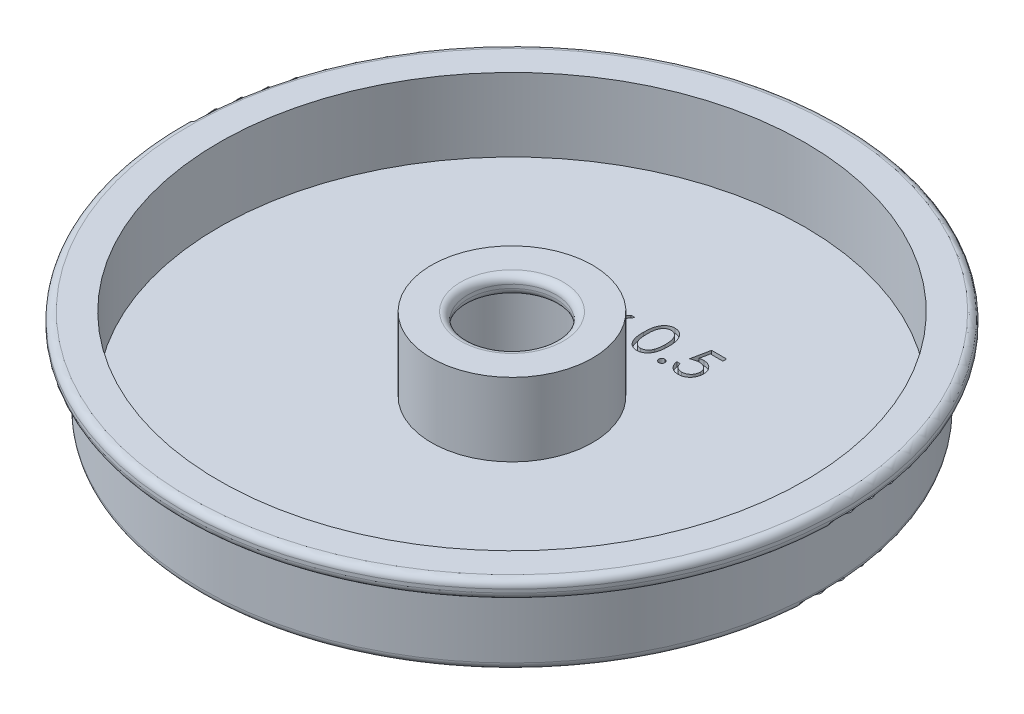
from build123d import *

# Parameters (mm, degrees)
CUT_EXTRUDE1_DEPTH = 0.79375


with BuildPart() as part:
    # Sketch1 → Revolve2 (revolve)
    with BuildSketch(Plane.XY):
        with BuildLine():
            Line((13.97, 3.211825196), (13.97, 15.911825196))
            Line((13.97, 15.911825196), (8.89, 15.911825196))
            ThreePointArc((8.89, 15.911825196), (7.991974388, 15.539850808), (7.62, 14.641825196))
            Line((7.62, 14.641825196), (7.62, 14.006825196))
            ThreePointArc((7.62, 14.006825196), (7.991974388, 13.108799584), (8.89, 12.736825196))
            Line((8.89, 12.736825196), (9.525, 12.736825196))
            ThreePointArc((9.525, 12.736825196), (10.423025612, 12.364850808), (10.795, 11.466825196))
            Line((10.795, 11.466825196), (10.795, 1.306825196))
            ThreePointArc((10.795, 1.306825196), (11.166974388, 0.408799584), (12.065, 0.036825196))
            Line((12.065, 0.036825196), (52.705, 0.036825196))
            ThreePointArc((52.705, 0.036825196), (53.603025612, 0.408799584), (53.975, 1.306825196))
            Line((53.975, 1.306825196), (53.975, 11.503650391))
            ThreePointArc((53.975, 11.503650391), (54.346974388, 12.401676004), (55.245, 12.773650391))
            Line((55.245, 12.773650391), (55.88, 12.773650391))
            ThreePointArc((55.88, 12.773650391), (56.778025612, 13.145624779), (57.15, 14.043650391))
            Line((57.15, 14.043650391), (57.15, 14.641825196))
            ThreePointArc((57.15, 14.641825196), (56.778025612, 15.539850808), (55.88, 15.911825196))
            Line((55.88, 15.911825196), (50.8, 15.911825196))
            Line((50.8, 15.911825196), (50.8, 3.211825196))
            Line((50.8, 3.211825196), (13.97, 3.211825196))
        make_face()
    revolve(axis=Axis((0, 0, 0), (0, 1, 0)))

    # Sketch2 → Cut-Extrude1 (cut)
    # profile 1 of 5: a face of its own
    with BuildSketch(Plane(origin=(0, 3.211825196, 0), x_dir=(1, 0, 0), z_dir=(0, 1, 0))):
        Polygon((-8.742863875, 24.357604302), (-8.627108666, 24.357604302), (-8.627108666, 19.961450455), (-7.894416359, 19.961450455), (-7.894416359, 19.310168404), (-8.627108666, 19.310168404), (-8.627108666, 17.844783789), (-9.196980461, 17.844783789), (-9.196980461, 19.310168404), (-12.209159948, 19.310168404), align=None)
        Polygon((-9.196980461, 19.961450455), (-9.196980461, 22.719222891), (-11.089768923, 19.961450455), align=None, mode=Mode.SUBTRACT)
    # profile 2 of 5: a face of its own
    with BuildSketch(Plane(origin=(0, 3.211825196, 0), x_dir=(1, 0, 0), z_dir=(0, 1, 0))):
        Polygon((-4.882236872, 22.485168404), (-4.20424208, 22.485168404), (-3.009800974, 20.811170007), (-1.815359868, 22.485168404), (-1.137365077, 22.485168404), (-2.670167561, 20.336700856), (-0.893134307, 17.844783789), (-1.571129099, 17.844783789), (-3.009800974, 19.86095967), (-4.448472849, 17.844783789), (-5.126467641, 17.844783789), (-3.348162352, 20.336700856), align=None)
    # profile 3 of 5: a face of its own
    with BuildSketch(Plane(origin=(0, 3.211825196, 0), x_dir=(1, 0, 0), z_dir=(0, 1, 0))):
        with BuildLine():
            add(Edge.make_bspline(
                [(1.793404154, 21.017239718), (1.793999273, 21.119016407), (1.795155299, 21.316719093), (1.80801572, 21.604799801), (1.829379556, 21.875056325), (1.858657361, 22.127501602), (1.894286268, 22.362200804), (1.94184865, 22.57852672), (1.995937592, 22.777480578), (2.058625601, 22.959711151), (2.12936059, 23.127673555), (2.206348463, 23.284473564), (2.29264459, 23.429873926), (2.383316989, 23.566195346), (2.482036033, 23.691206335), (2.58599241, 23.806672309), (2.699243529, 23.90992467), (2.817939558, 24.003988676), (2.943155143, 24.086447003), (3.071321123, 24.159077829), (3.203319672, 24.22112616), (3.339511176, 24.269913093), (3.478671531, 24.310209915), (3.621287209, 24.337767006), (3.767593683, 24.355105969), (3.866347858, 24.356763623), (3.916430997, 24.357604302)],
                knots=[0, 0, 0, 0, 1.646270934, 3.197905019, 4.663502075, 6.030701355, 7.308322542, 8.50163776, 9.611534131, 10.641858119, 11.616356847, 12.558055219, 13.465016945, 14.349605745, 15.204443733, 16.039544428, 16.859896111, 17.680448484, 18.487036065, 19.28249412, 20.06191084, 20.843045899, 21.620316918, 22.403196591, 23.190181807, 24, 24, 24, 24], degree=3))
            add(Edge.make_bspline(
                [(3.916430997, 24.357604302), (3.966932508, 24.356719266), (4.067364124, 24.354959207), (4.215845948, 24.338042911), (4.360897513, 24.309973874), (4.501900422, 24.270202963), (4.640012897, 24.220862235), (4.774154666, 24.159018465), (4.905158942, 24.087029663), (5.030943893, 24.002440629), (5.152890409, 23.908129928), (5.268003142, 23.801517657), (5.376292569, 23.683680309), (5.479117766, 23.555878642), (5.573561492, 23.415661417), (5.663501862, 23.265467389), (5.744005413, 23.102669963), (5.821538324, 22.9299854), (5.888461857, 22.742635619), (5.94881633, 22.541676696), (5.997582459, 22.324734957), (6.038202996, 22.092948626), (6.069671593, 21.845466478), (6.092590815, 21.58281902), (6.104697698, 21.304833454), (6.106977713, 21.114772785), (6.108147744, 21.017239718)],
                knots=[0, 0, 0, 0, 0.810914788, 1.612654377, 2.396697861, 3.181598691, 3.963628158, 4.749916497, 5.551656086, 6.361998678, 7.18212741, 8.025565596, 8.878627764, 9.750805457, 10.657531673, 11.591944965, 12.560506719, 13.57287815, 14.630710178, 15.753379473, 16.941251878, 18.199788006, 19.531962791, 20.947069417, 22.433333509, 24, 24, 24, 24], degree=3))
            add(Edge.make_bspline(
                [(6.108147744, 21.017239718), (6.106965583, 20.920132057), (6.104662192, 20.730921738), (6.092726538, 20.454186969), (6.069215879, 20.192933376), (6.039806328, 19.946534394), (5.999073867, 19.716015571), (5.948990208, 19.500579215), (5.893381765, 19.299294971), (5.824738639, 19.113811812), (5.749607779, 18.941542258), (5.66786478, 18.780674717), (5.580289524, 18.629787301), (5.484878515, 18.49008776), (5.383181608, 18.360586482), (5.273022192, 18.243569367), (5.157505559, 18.136216862), (5.035200176, 18.040691766), (4.907453504, 17.957080764), (4.776899179, 17.882307064), (4.641220755, 17.82201346), (4.503492969, 17.770242743), (4.361745791, 17.730690494), (4.21615591, 17.703342213), (4.067463882, 17.68416186), (3.966949614, 17.682698675), (3.916430997, 17.681963276)],
                knots=[0, 0, 0, 0, 1.561518951, 3.042555995, 4.452378317, 5.7783523, 7.031515105, 8.214008947, 9.334062868, 10.386615937, 11.391082383, 12.354592575, 13.286541444, 14.194233754, 15.072674879, 15.931287219, 16.775624067, 17.606195743, 18.42308326, 19.229000347, 20.022332153, 20.807536673, 21.593273796, 22.3848459, 23.188221202, 24, 24, 24, 24], degree=3))
            add(Edge.make_bspline(
                [(3.916430997, 17.681963276), (3.866349247, 17.682809378), (3.767597812, 17.684477726), (3.621271269, 17.701738353), (3.47924455, 17.729488766), (3.340816811, 17.768344605), (3.205277848, 17.815905808), (3.074474585, 17.877870348), (2.946952644, 17.949233588), (2.82305225, 18.030505281), (2.705101615, 18.123617477), (2.592437002, 18.226604115), (2.487888754, 18.342035162), (2.39058118, 18.468087965), (2.29809962, 18.603602848), (2.2130289, 18.750430039), (2.134341779, 18.907987346), (2.06241716, 19.077292698), (1.998647442, 19.260816639), (1.942318029, 19.46065872), (1.897842343, 19.678582803), (1.859773267, 19.912838597), (1.829067601, 20.164432728), (1.808104753, 20.433501783), (1.795148367, 20.71987809), (1.793996168, 20.916310395), (1.793404154, 21.017239718)],
                knots=[0, 0, 0, 0, 0.810891512, 1.598919785, 2.382837074, 3.152667961, 3.926044502, 4.706494248, 5.493654104, 6.291793342, 7.103789334, 7.925228297, 8.761435821, 9.622817696, 10.50288917, 11.416980706, 12.369136599, 13.353924996, 14.394355917, 15.514179734, 16.714354668, 17.994756427, 19.357759367, 20.818452758, 22.365282078, 24, 24, 24, 24], degree=3))
        make_face()
        with BuildLine():
            add(Edge.make_bspline(
                [(2.363275949, 21.019783789), (2.36349266, 20.934968292), (2.363913254, 20.770358068), (2.374900932, 20.531156723), (2.38986921, 20.308053412), (2.409175564, 20.100764853), (2.437846627, 19.909992688), (2.469971799, 19.734424834), (2.509066191, 19.574990418), (2.555321437, 19.43059539), (2.608006656, 19.298789223), (2.665530151, 19.176141304), (2.727326034, 19.061202791), (2.796485065, 18.955006102), (2.871805251, 18.857204918), (2.951585307, 18.766068208), (3.03880271, 18.684793685), (3.1594595, 18.587317819), (3.318747389, 18.486590248), (3.519444501, 18.398876628), (3.725671547, 18.343754171), (3.865645958, 18.336744214), (3.935511526, 18.333245327)],
                knots=[0, 0, 0, 0, 1.459021318, 2.831673884, 4.118529203, 5.306027144, 6.411944654, 7.436330062, 8.375795394, 9.233974572, 10.042671642, 10.816086306, 11.563610507, 12.285937304, 12.993564865, 13.685989202, 14.367179055, 15.041617293, 16.353048772, 17.594441528, 18.799311195, 20, 20, 20, 20], degree=3))
            add(Edge.make_bspline(
                [(3.935511526, 18.333245327), (4.005829016, 18.336144158), (4.146318817, 18.341935835), (4.351575845, 18.397813544), (4.550839335, 18.482122566), (4.706998427, 18.58181304), (4.82580247, 18.67675158), (4.910923295, 18.7576953), (4.989050154, 18.848329516), (5.063149347, 18.946118239), (5.131110813, 19.052929746), (5.192911077, 19.168250418), (5.24930515, 19.292400498), (5.281434419, 19.379068453), (5.297861286, 19.423379542)],
                knots=[0, 0, 0, 0, 1.353760809, 2.704726607, 4.075137775, 5.516104923, 6.260822281, 7.007110065, 7.778089737, 8.566572457, 9.372053459, 10.217411131, 11.088608312, 12, 12, 12, 12], degree=3))
            add(Edge.make_bspline(
                [(5.297861286, 19.423379542), (5.317005207, 19.480039212), (5.355875578, 19.595082642), (5.405971226, 19.77354241), (5.445423593, 19.960781711), (5.480917128, 20.155681565), (5.505143386, 20.359679309), (5.52464299, 20.572143748), (5.536128665, 20.793235077), (5.537552428, 20.943448846), (5.538275949, 21.019783789)],
                knots=[0, 0, 0, 0, 0.884706709, 1.796334032, 2.740027952, 3.714592787, 4.726048262, 5.777819803, 6.87074269, 8, 8, 8, 8], degree=3))
            add(Edge.make_bspline(
                [(5.538275949, 21.019783789), (5.537277749, 21.096106385), (5.535325055, 21.245409698), (5.527861106, 21.464064111), (5.508586906, 21.671741335), (5.487179934, 21.869336049), (5.455616404, 22.055754456), (5.421584383, 22.232557152), (5.375862183, 22.397553783), (5.32702202, 22.553327596), (5.27112316, 22.698108783), (5.209590328, 22.832572367), (5.143873708, 22.95736751), (5.072495643, 23.072151819), (4.996303476, 23.177439432), (4.913286208, 23.27111934), (4.826736846, 23.356094982), (4.70551138, 23.453091357), (4.546808026, 23.551991148), (4.349330923, 23.643006169), (4.143825611, 23.695272643), (4.004899487, 23.702641704), (3.935511526, 23.70632225)],
                knots=[0, 0, 0, 0, 1.31362396, 2.569729283, 3.763502607, 4.902122613, 5.988968491, 7.01645872, 7.998833611, 8.933434873, 9.825090667, 10.667526885, 11.477055099, 12.250526234, 12.991942729, 13.710640831, 14.402115721, 15.076753259, 16.378508321, 17.609869233, 18.806226677, 20, 20, 20, 20], degree=3))
            add(Edge.make_bspline(
                [(3.935511526, 23.70632225), (3.865279452, 23.702636626), (3.724687357, 23.695258662), (3.517046068, 23.643200902), (3.31801103, 23.552463092), (3.159727347, 23.452763788), (3.038417335, 23.357807137), (2.952995877, 23.275463142), (2.872902107, 23.185390652), (2.79911928, 23.086690035), (2.730014437, 22.980617154), (2.666548886, 22.866337538), (2.609367445, 22.743272063), (2.556599786, 22.611525102), (2.510203442, 22.467142531), (2.471932966, 22.3079045), (2.436577884, 22.132895068), (2.411549325, 21.941089675), (2.389299368, 21.733749197), (2.375000351, 21.510088919), (2.363876498, 21.2704864), (2.363480141, 21.10502507), (2.363275949, 21.019783789)],
                knots=[0, 0, 0, 0, 1.207732386, 2.417664972, 3.655092373, 4.956220595, 5.625982001, 6.301752483, 6.994047911, 7.697131622, 8.419323945, 9.170223765, 9.943494443, 10.752040957, 11.610060368, 12.549350801, 13.567764191, 14.679664412, 15.874934091, 17.154273443, 18.533957287, 20, 20, 20, 20], degree=3))
        make_face(mode=Mode.SUBTRACT)
    # profile 4 of 5: a face of its own
    with BuildSketch(Plane(origin=(0, 3.211825196, 0), x_dir=(1, 0, 0), z_dir=(0, 1, 0))):
        with BuildLine():
            add(Edge.make_bspline(
                [(7.695647744, 18.821706866), (7.731008557, 18.81960562), (7.800329298, 18.815486375), (7.90054886, 18.787225838), (7.991253457, 18.737045125), (8.072047672, 18.670165513), (8.138643708, 18.58907481), (8.190612747, 18.499093661), (8.218627106, 18.398035058), (8.222716346, 18.328312648), (8.224814411, 18.292540199)],
                knots=[0, 0, 0, 0, 1.020151414, 1.999887582, 2.974338812, 3.990962822, 5.007586832, 5.987933904, 6.967670073, 8, 8, 8, 8], degree=3))
            add(Edge.make_bspline(
                [(8.224814411, 18.292540199), (8.222645249, 18.257627301), (8.218367695, 18.188779578), (8.190676963, 18.08848321), (8.138247643, 17.998445826), (8.072507013, 17.916254804), (7.991233484, 17.84923351), (7.90033442, 17.799479728), (7.800564565, 17.769195707), (7.731047807, 17.765337997), (7.695647744, 17.763373532)],
                knots=[0, 0, 0, 0, 1.009421747, 1.99056486, 2.972319754, 3.999869655, 5.017953583, 5.993804169, 6.978383603, 8, 8, 8, 8], degree=3))
            add(Edge.make_bspline(
                [(7.695647744, 17.763373532), (7.660222172, 17.765266916), (7.591062177, 17.768963296), (7.49166473, 17.800101531), (7.400212087, 17.848766951), (7.318954381, 17.916379773), (7.252663154, 17.99802289), (7.202542817, 18.089103292), (7.172443547, 18.188492471), (7.168485006, 18.257570752), (7.166481077, 18.292540199)],
                knots=[0, 0, 0, 0, 1.022052826, 1.995314843, 2.982371812, 4.00089066, 5.028879526, 6.005146991, 6.990147033, 8, 8, 8, 8], degree=3))
            add(Edge.make_bspline(
                [(7.166481077, 18.292540199), (7.168408029, 18.328371216), (7.172170165, 18.39832688), (7.202606006, 18.498473833), (7.252274276, 18.589493715), (7.319412635, 18.670041796), (7.400192429, 18.737510188), (7.491444116, 18.786613456), (7.591301568, 18.815715346), (7.660262456, 18.819675055), (7.695647744, 18.821706866)],
                knots=[0, 0, 0, 0, 1.032775665, 2.016367738, 2.991239715, 4.008302682, 5.025365648, 6.011011707, 6.979408107, 8, 8, 8, 8], degree=3))
        make_face()
    # profile 5 of 5: a face of its own
    with BuildSketch(Plane(origin=(0, 3.211825196, 0), x_dir=(1, 0, 0), z_dir=(0, 1, 0))):
        with BuildLine():
            Line((13.028019539, 24.194783789), (13.028019539, 23.543501738))
            Line((13.028019539, 23.543501738), (10.868103673, 23.543501738))
            Line((10.868103673, 23.543501738), (10.525926189, 21.873319446))
            add(Edge.make_bspline(
                [(10.525926189, 21.873319446), (10.593156133, 21.891880082), (10.723403515, 21.927838379), (10.915644977, 21.967763133), (11.098147975, 21.991830439), (11.216576147, 21.995116674), (11.27388292, 21.996706866)],
                knots=[0, 0, 0, 0, 1.100273476, 2.13160584, 3.095893838, 4, 4, 4, 4], degree=3))
            add(Edge.make_bspline(
                [(11.27388292, 21.996706866), (11.344791991, 21.995172097), (11.48421694, 21.992154357), (11.688213315, 21.963176859), (11.88294585, 21.917565871), (12.068007293, 21.85384721), (12.243740007, 21.772368123), (12.408527154, 21.670586802), (12.564842225, 21.551690616), (12.709880931, 21.414993237), (12.841460747, 21.264549732), (12.957150471, 21.102791881), (13.055416885, 20.931291694), (13.13444854, 20.748410589), (13.197557261, 20.556170411), (13.239561594, 20.35254844), (13.267531909, 20.139463993), (13.27065681, 19.993768559), (13.272250308, 19.919473292)],
                knots=[0, 0, 0, 0, 1.052922333, 2.070308379, 3.05430497, 4.020497103, 4.973039431, 5.925935799, 6.892292201, 7.88610001, 8.88166317, 9.857072816, 10.836096531, 11.812156883, 12.81219415, 13.836441305, 14.89672472, 16, 16, 16, 16], degree=3))
            add(Edge.make_bspline(
                [(13.272250308, 19.919473292), (13.271043671, 19.867725835), (13.268646705, 19.764930243), (13.256457267, 19.612268622), (13.232988182, 19.462838911), (13.201478169, 19.316621285), (13.160579782, 19.173892567), (13.111069641, 19.034244224), (13.050479706, 18.898545437), (12.984019925, 18.765512221), (12.909187029, 18.638152072), (12.826131737, 18.519046053), (12.738382917, 18.406407428), (12.643964975, 18.301444227), (12.542000312, 18.20484618), (12.433723801, 18.116040012), (12.319999439, 18.033523885), (12.199067786, 17.960647302), (12.073623566, 17.893585939), (11.94185523, 17.838570378), (11.806762245, 17.789384134), (11.666400256, 17.750178277), (11.521087196, 17.719457785), (11.370583532, 17.69859241), (11.215678602, 17.683395159), (11.110676793, 17.682443826), (11.057636927, 17.681963276)],
                knots=[0, 0, 0, 0, 1.056347294, 2.098418968, 3.122841568, 4.141288669, 5.149314143, 6.15115421, 7.162517403, 8.180376062, 9.185164535, 10.17417709, 11.141909838, 12.097768115, 13.052685741, 14.0056014, 14.954263652, 15.917497458, 16.885230207, 17.854509472, 18.828990115, 19.81800267, 20.826176721, 21.857883937, 22.917946725, 24, 24, 24, 24], degree=3))
            add(Edge.make_bspline(
                [(11.057636927, 17.681963276), (10.994365199, 17.683216653), (10.869885549, 17.685682526), (10.68751252, 17.71147892), (10.512044592, 17.748424883), (10.344894266, 17.80400783), (10.184563545, 17.87365335), (10.0332109, 17.961675547), (9.886968992, 18.061423349), (9.751782868, 18.179134847), (9.626313919, 18.307796156), (9.513997824, 18.447419305), (9.413969764, 18.595699864), (9.327831566, 18.753357943), (9.254356584, 18.919979278), (9.196635105, 19.096188151), (9.150047233, 19.281063873), (9.130337884, 19.408342384), (9.120327231, 19.472988917)],
                knots=[0, 0, 0, 0, 1.0467383, 2.05933395, 3.04377827, 4.011590433, 4.970194871, 5.932262533, 6.905835911, 7.896367577, 8.894135286, 9.877477877, 10.858688626, 11.851381753, 12.8477658, 13.868841284, 14.917554742, 16, 16, 16, 16], degree=3))
            Line((9.120327231, 19.472988917), (9.690199026, 19.472988917))
            add(Edge.make_bspline(
                [(9.690199026, 19.472988917), (9.704220837, 19.412434496), (9.731171537, 19.296045537), (9.790327681, 19.132521532), (9.86265577, 18.986799512), (9.948660802, 18.856951839), (10.051258714, 18.743724087), (10.168333535, 18.642818846), (10.299592976, 18.551786826), (10.445449264, 18.475908377), (10.599324422, 18.411195067), (10.760373503, 18.368102706), (10.924211389, 18.337802515), (11.035025003, 18.334769463), (11.090709843, 18.333245327)],
                knots=[0, 0, 0, 0, 1.136247022, 2.183929868, 3.172523383, 4.106158343, 5.02341133, 5.958108904, 6.928429099, 7.938127109, 8.96079061, 9.975095812, 10.982467395, 12, 12, 12, 12], degree=3))
            add(Edge.make_bspline(
                [(11.090709843, 18.333245327), (11.145063021, 18.334734453), (11.252084873, 18.337666553), (11.409585531, 18.360234475), (11.561646032, 18.394991783), (11.70676595, 18.447007092), (11.847484744, 18.510225366), (11.98024287, 18.59135129), (12.108880947, 18.684714466), (12.229400561, 18.791678638), (12.339780704, 18.909552227), (12.437309667, 19.035604069), (12.518547781, 19.170073205), (12.587008236, 19.310631639), (12.638993507, 19.458819879), (12.676079287, 19.613943439), (12.697856265, 19.776385475), (12.700851977, 19.887182651), (12.702378513, 19.943641962)],
                knots=[0, 0, 0, 0, 1.027316725, 2.022795036, 3.002884548, 3.971462791, 4.93288096, 5.914575861, 6.907176829, 7.935150275, 8.956128384, 9.956726525, 10.942570165, 11.921478529, 12.907843606, 13.90538589, 14.932640048, 16, 16, 16, 16], degree=3))
            add(Edge.make_bspline(
                [(12.702378513, 19.943641962), (12.701183843, 19.994579397), (12.698845447, 20.094282179), (12.679739984, 20.24014931), (12.646507762, 20.378167544), (12.60038158, 20.509003369), (12.54181733, 20.632780185), (12.47025045, 20.749625737), (12.384337856, 20.857999978), (12.286199715, 20.957953611), (12.178688698, 21.050200741), (12.059955051, 21.128839298), (11.932483469, 21.194995263), (11.797809768, 21.252087202), (11.652730594, 21.293091412), (11.50011899, 21.323876004), (11.338326963, 21.341683876), (11.227708714, 21.344154731), (11.170848064, 21.345424814)],
                knots=[0, 0, 0, 0, 1.045622112, 2.046656509, 3.013763289, 3.955457236, 4.890082067, 5.820317437, 6.762574623, 7.722996705, 8.69280354, 9.665887285, 10.63943826, 11.638615906, 12.663482002, 13.728887084, 14.832589034, 16, 16, 16, 16], degree=3))
            add(Edge.make_bspline(
                [(11.170848064, 21.345424814), (11.121628436, 21.344371456), (11.020002392, 21.342196539), (10.864113835, 21.326182752), (10.700298852, 21.300348603), (10.52918541, 21.264813554), (10.350259631, 21.218311458), (10.163899104, 21.162586578), (9.969711991, 21.09596238), (9.838869834, 21.045648221), (9.771609282, 21.019783789)],
                knots=[0, 0, 0, 0, 0.817624296, 1.688186739, 2.600797293, 3.572016777, 4.590301741, 5.671205678, 6.80286297, 8, 8, 8, 8], degree=3))
            Line((9.771609282, 21.019783789), (10.422891334, 24.194783789))
            Line((10.422891334, 24.194783789), (13.028019539, 24.194783789))
        make_face()
    extrude(amount=-CUT_EXTRUDE1_DEPTH, mode=Mode.SUBTRACT)


solid = part.part
